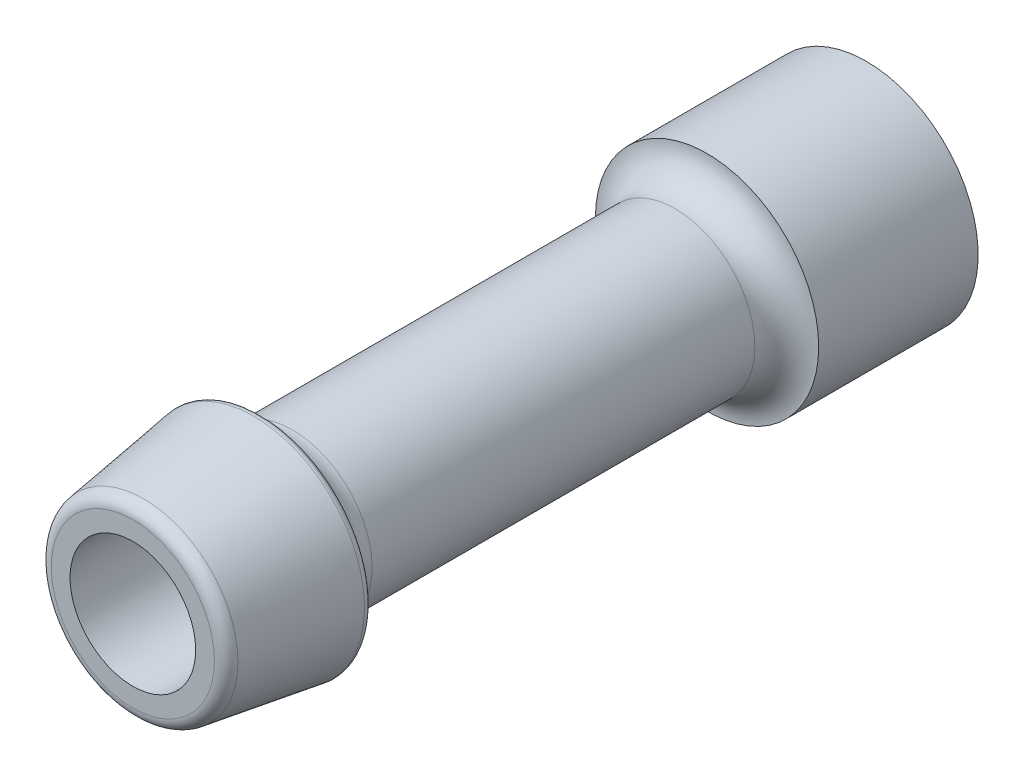
from build123d import *

# Parameters (mm, degrees)
SKETCH1_R           = 4.445
BOSS_EXTRUDE1_DEPTH = 29.21
SKETCH2_R           = 2.5
CUT_EXTRUDE1_START  = -5.08
SKETCH3_R           = 6.35
SKETCH3_R_2         = 3.175
CUT_EXTRUDE1_DEPTH  = 17.78
FILLET1_R           = 1.27
FILLET2_R           = 1.27
CHAMFER1_SIZE       = 5.08
CHAMFER1_SIZE_2     = 0.759211087
FILLET3_R           = 0.254
FILLET4_R           = 0.508


# Some blends are built 0.0001 mm under size
with BuildPart() as part:
    # Sketch1 → Boss-Extrude1 (new body)
    with BuildSketch(Plane.XY):
        with Locations(Location((0, 0, 0), (0, 0, 180))):
            Circle(SKETCH1_R)
    extrude(amount=BOSS_EXTRUDE1_DEPTH)

    # Cut-Sweep1: sweep along a curve in space
    with BuildLine() as cut_sweep1_path:
        Line((0, 0, 29.21), (0, 0, 0))
    # Sketch2 → Cut-Sweep1 (sweep, cut)
    with BuildSketch(Plane.XY.offset(29.21)):
        Circle(SKETCH2_R)
    sweep(path=cut_sweep1_path.line, mode=Mode.SUBTRACT)

    # Sketch3 → Cut-Extrude1 (cut)
    with BuildSketch(Plane.XY.offset(29.21).offset(CUT_EXTRUDE1_START)):
        Circle(SKETCH3_R)
        Circle(SKETCH3_R_2, mode=Mode.SUBTRACT)
    extrude(amount=-CUT_EXTRUDE1_DEPTH, mode=Mode.SUBTRACT)

    # Fillet1
    fillet1_edges = [part.edges().sort_by_distance(p)[0] for p in [
        (-3.175, 0, 6.35),
    ]]
    fillet(fillet1_edges, radius=FILLET1_R - 0.0001)  # a hair under: the kernel refuses the full size

    # Fillet2
    fillet2_edges = [part.edges().sort_by_distance(p)[0] for p in [
        (-3.175, 0, 24.13),
    ]]
    fillet(fillet2_edges, radius=FILLET2_R - 0.0001)  # a hair under: the kernel refuses the full size

    # Chamfer1
    # the kernel refuses this chamfer: 5.08, 0.759211087 mm, written as the material it takes off along each edge
    with BuildSketch(Plane(origin=(0, 0, 29.21), x_dir=(-1, 0, 0), z_dir=(0, 1, 0))) as chamfer1_piece_1:
        Polygon((4.445, -CHAMFER1_SIZE), (4.445 - CHAMFER1_SIZE_2, 0), (4.445, 0), align=None)
    revolve(axis=Axis((0, 0, 29.21), (0, 0, 1)), mode=Mode.SUBTRACT)

    # Fillet3
    fillet3_edges = [part.edges().sort_by_distance(p)[0] for p in [
        (4.445, 0, 24.13),
    ]]
    fillet(fillet3_edges, radius=FILLET3_R)

    # Fillet4
    fillet4_edges = [part.edges().sort_by_distance(p)[0] for p in [
        (3.685788913, 0, 29.21),
    ]]
    fillet(fillet4_edges, radius=FILLET4_R)


solid = part.part
